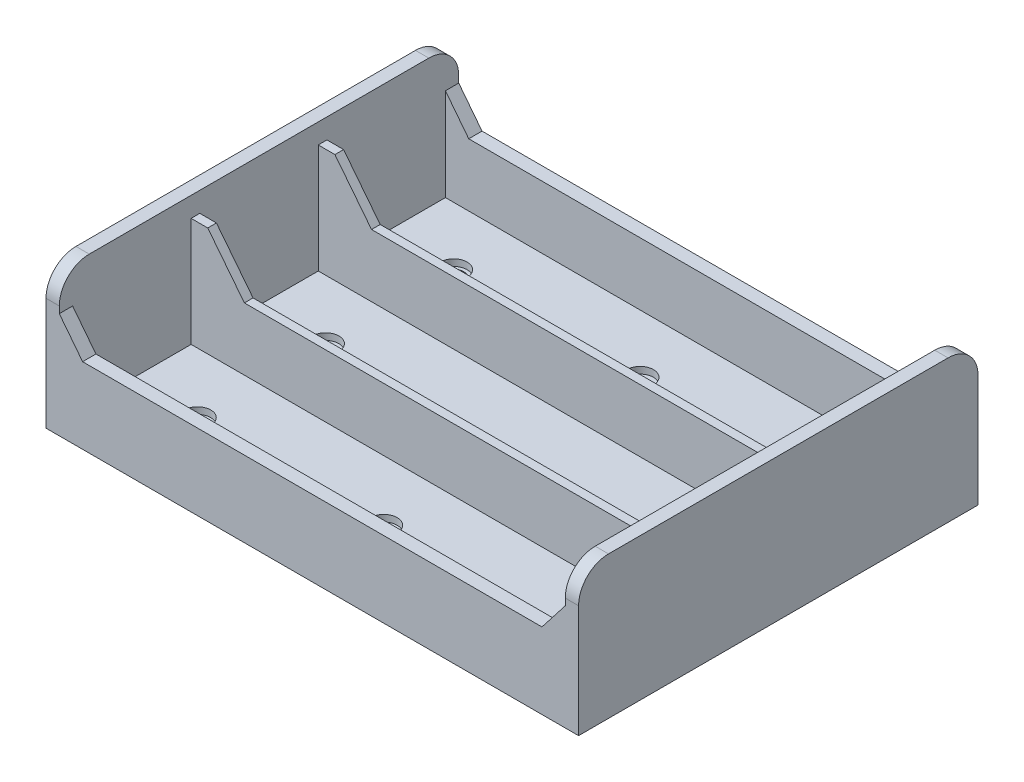
from build123d import *

# Parameters (mm, degrees)
SKETCH_1_W          = 80
SKETCH_1_H          = 60
EXTRUDE_1_DEPTH     = 21.4
FILLET_1_R          = 4.5
CUT_EXTRUDE_1_DEPTH = 77.675595548
SKETCH_3_W          = 76
SKETCH_3_H          = 56
CUT_EXTRUDE_2_DEPTH = 19.4
SKETCH_4_W          = 76
SKETCH_4_H          = 1.3
EXTRUDE_2_DEPTH     = 16.4
CUT_EXTRUDE_3_DEPTH = 26.4
CUT_EXTRUDE_4_REACH = 63.858
SKETCH_6_R          = 1.25
SKETCH_6_R_2        = 1.5
SKETCH_7_R          = 2
CUT_EXTRUDE_5_DEPTH = 1


with BuildPart() as part:
    # 草图1 → 凸台-拉伸1 (new body)
    with BuildSketch(Plane(origin=(0, 0, 0), x_dir=(1, 0, 0), z_dir=(0, 1, 0))):
        with Locations((2.675367047, -10.358890701)):
            Rectangle(SKETCH_1_W, SKETCH_1_H)
    extrude(amount=EXTRUDE_1_DEPTH)

    # 圆角1
    fillet_1_edges = [part.edges().sort_by_distance(p)[0] for p in [
        (2.675367047, 21.4, -19.641109299),
        (2.675367047, 21.4, 40.358890701),
    ]]
    fillet(fillet_1_edges, radius=FILLET_1_R)

    # 草图2 → 切除-拉伸1 (cut, through all)
    with BuildSketch(Plane.XY.offset(40.358890701)):
        Polygon((40.675367047, 21.4), (-35.324632953, 21.4), (-35.324632953, 15.9), (-31.824632953, 11.4), (37.175367047, 11.4), (40.675367047, 15.9), align=None)
    extrude(amount=-CUT_EXTRUDE_1_DEPTH, mode=Mode.SUBTRACT)

    # 草图3 → 切除-拉伸2 (cut)
    with BuildSketch(Plane(origin=(0, 21.4, 0), x_dir=(1, 0, 0), z_dir=(0, 1, 0))):
        with Locations((2.675367047, -10.358890701)):
            Rectangle(SKETCH_3_W, SKETCH_3_H)
    extrude(amount=-CUT_EXTRUDE_2_DEPTH, mode=Mode.SUBTRACT)

    # 草图4 → 凸台-拉伸2 (add)
    with BuildSketch(Plane(origin=(0, 2, 0), x_dir=(1, 0, 0), z_dir=(0, 1, 0))):
        with Locations((2.675367047, -0.808890701)):
            Rectangle(SKETCH_4_W, SKETCH_4_H)
        with Locations((2.675367047, -19.908890701)):
            Rectangle(SKETCH_4_W, SKETCH_4_H)
    extrude(amount=EXTRUDE_2_DEPTH)

    # 草图5 → 切除-拉伸3 (cut)
    with BuildSketch(Plane.XY.offset(20.558890701)):
        Polygon((-32.824984691, 18.4), (-27.324632953, 11.4), (32.675367047, 11.4), (38.175367047, 18.4), align=None)
    extrude(amount=-CUT_EXTRUDE_3_DEPTH, mode=Mode.SUBTRACT)

    # 草图6 → 切除-拉伸4 (cut, up to next)
    with BuildSketch(Plane(origin=(0, 2, 0), x_dir=(1, 0, 0), z_dir=(0, 1, 0)), mode=Mode.PRIVATE) as cut_extrude_4_sk1:
        with Locations((2.675367047, 8.891109299)):
            Circle(SKETCH_6_R)
    cut_extrude_4_tool1 = extrude(cut_extrude_4_sk1.sketch, amount=-CUT_EXTRUDE_4_REACH, mode=Mode.PRIVATE) & part.part
    # 草图6 → 切除-拉伸4 (cut, up to next)
    with BuildSketch(Plane(origin=(0, 2, 0), x_dir=(1, 0, 0), z_dir=(0, 1, 0)), mode=Mode.PRIVATE) as cut_extrude_4_sk2:
        with Locations((2.675367047, -29.608890701)):
            Circle(SKETCH_6_R)
    cut_extrude_4_tool2 = extrude(cut_extrude_4_sk2.sketch, amount=-CUT_EXTRUDE_4_REACH, mode=Mode.PRIVATE) & part.part
    # 草图6 → 切除-拉伸4 (cut, up to next)
    with BuildSketch(Plane(origin=(0, 2, 0), x_dir=(1, 0, 0), z_dir=(0, 1, 0)), mode=Mode.PRIVATE) as cut_extrude_4_sk3:
        with Locations((-25.324632953, 8.891109299)):
            Circle(SKETCH_6_R_2)
    cut_extrude_4_tool3 = extrude(cut_extrude_4_sk3.sketch, amount=-CUT_EXTRUDE_4_REACH, mode=Mode.PRIVATE) & part.part
    # 草图6 → 切除-拉伸4 (cut, up to next)
    with BuildSketch(Plane(origin=(0, 2, 0), x_dir=(1, 0, 0), z_dir=(0, 1, 0)), mode=Mode.PRIVATE) as cut_extrude_4_sk4:
        with Locations((30.675367047, 8.891109299)):
            Circle(SKETCH_6_R_2)
    cut_extrude_4_tool4 = extrude(cut_extrude_4_sk4.sketch, amount=-CUT_EXTRUDE_4_REACH, mode=Mode.PRIVATE) & part.part
    # 草图6 → 切除-拉伸4 (cut, up to next)
    with BuildSketch(Plane(origin=(0, 2, 0), x_dir=(1, 0, 0), z_dir=(0, 1, 0)), mode=Mode.PRIVATE) as cut_extrude_4_sk5:
        with Locations((30.675367047, -10.829122265)):
            Circle(SKETCH_6_R_2)
    cut_extrude_4_tool5 = extrude(cut_extrude_4_sk5.sketch, amount=-CUT_EXTRUDE_4_REACH, mode=Mode.PRIVATE) & part.part
    # 草图6 → 切除-拉伸4 (cut, up to next)
    with BuildSketch(Plane(origin=(0, 2, 0), x_dir=(1, 0, 0), z_dir=(0, 1, 0)), mode=Mode.PRIVATE) as cut_extrude_4_sk6:
        with Locations((30.675367047, -29.608890701)):
            Circle(SKETCH_6_R_2)
    cut_extrude_4_tool6 = extrude(cut_extrude_4_sk6.sketch, amount=-CUT_EXTRUDE_4_REACH, mode=Mode.PRIVATE) & part.part
    # 草图6 → 切除-拉伸4 (cut, up to next)
    with BuildSketch(Plane(origin=(0, 2, 0), x_dir=(1, 0, 0), z_dir=(0, 1, 0)), mode=Mode.PRIVATE) as cut_extrude_4_sk7:
        with Locations((-25.324632953, -29.608890701)):
            Circle(SKETCH_6_R_2)
    cut_extrude_4_tool7 = extrude(cut_extrude_4_sk7.sketch, amount=-CUT_EXTRUDE_4_REACH, mode=Mode.PRIVATE) & part.part
    # 草图6 → 切除-拉伸4 (cut, up to next)
    with BuildSketch(Plane(origin=(0, 2, 0), x_dir=(1, 0, 0), z_dir=(0, 1, 0)), mode=Mode.PRIVATE) as cut_extrude_4_sk8:
        with Locations((-25.324632953, -10.358890701)):
            Circle(SKETCH_6_R_2)
    cut_extrude_4_tool8 = extrude(cut_extrude_4_sk8.sketch, amount=-CUT_EXTRUDE_4_REACH, mode=Mode.PRIVATE) & part.part
    add(cut_extrude_4_tool1.solids().sort_by_distance((2.675367, 2, -8.891109))[0], mode=Mode.SUBTRACT)
    add(cut_extrude_4_tool2.solids().sort_by_distance((2.675367, 2, 29.608891))[0], mode=Mode.SUBTRACT)
    add(cut_extrude_4_tool3.solids().sort_by_distance((-25.324633, 2, -8.891109))[0], mode=Mode.SUBTRACT)
    add(cut_extrude_4_tool4.solids().sort_by_distance((30.675367, 2, -8.891109))[0], mode=Mode.SUBTRACT)
    add(cut_extrude_4_tool5.solids().sort_by_distance((30.675367, 2, 10.829122))[0], mode=Mode.SUBTRACT)
    add(cut_extrude_4_tool6.solids().sort_by_distance((30.675367, 2, 29.608891))[0], mode=Mode.SUBTRACT)
    add(cut_extrude_4_tool7.solids().sort_by_distance((-25.324633, 2, 29.608891))[0], mode=Mode.SUBTRACT)
    add(cut_extrude_4_tool8.solids().sort_by_distance((-25.324633, 2, 10.358891))[0], mode=Mode.SUBTRACT)

    # 草图7 → 切除-拉伸5 (cut)
    with BuildSketch(Plane(origin=(0, 2, 0), x_dir=(1, 0, 0), z_dir=(0, 1, 0))):
        with Locations((-25.324632953, 8.891109299)):
            Circle(SKETCH_7_R)
        with Locations((2.675367047, 8.891109299)):
            Circle(SKETCH_7_R)
        with Locations((30.675367047, 8.891109299)):
            Circle(SKETCH_7_R)
        with Locations((-25.324632953, -10.358890701)):
            Circle(SKETCH_7_R)
        with Locations((30.675367047, -10.829122265)):
            Circle(SKETCH_7_R)
        with Locations((-25.324632953, -29.608890701)):
            Circle(SKETCH_7_R)
        with Locations((2.675367047, -29.608890701)):
            Circle(SKETCH_7_R)
        with Locations((30.675367047, -29.608890701)):
            Circle(SKETCH_7_R)
    extrude(amount=-CUT_EXTRUDE_5_DEPTH, mode=Mode.SUBTRACT)


solid = part.part
